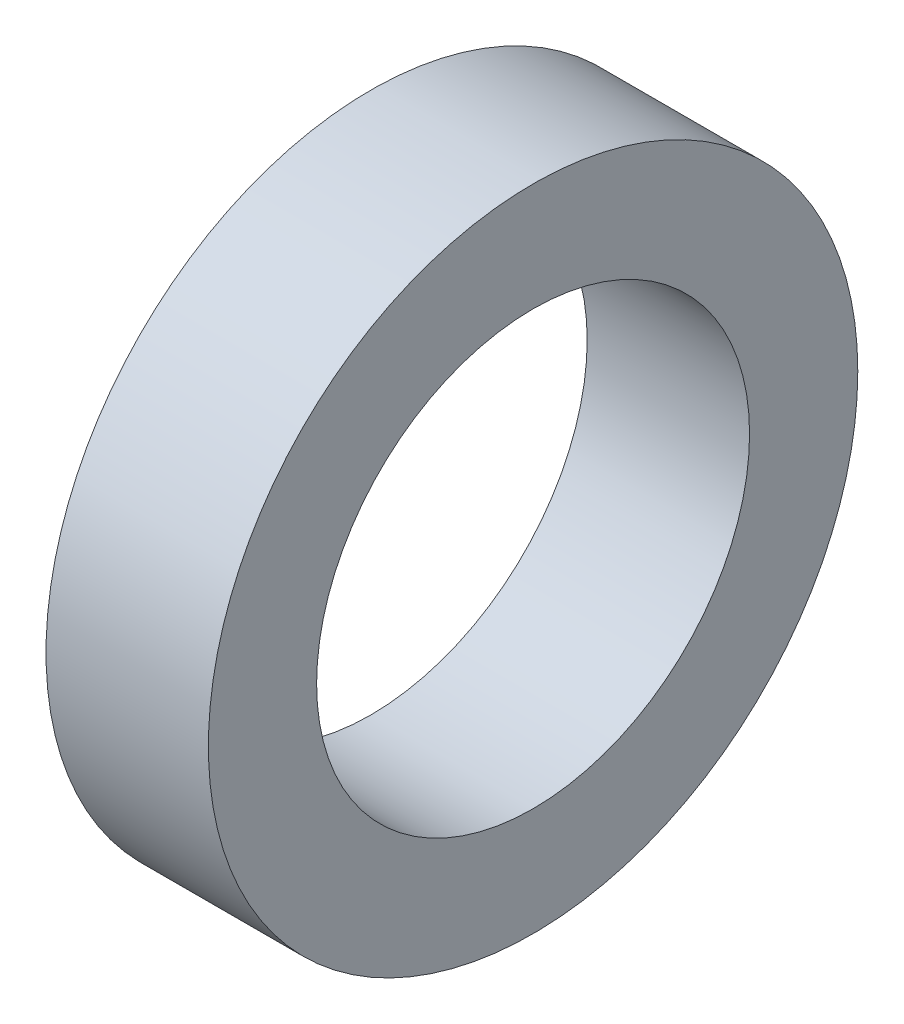
from build123d import *

# Parameters (mm, degrees)
SKETCH2_R           = 30
SKETCH2_R_2         = 20
BOSS_EXTRUDE6_DEPTH = 15


with BuildPart() as part:
    # Sketch2 → Boss-Extrude6 (new body)
    with BuildSketch(Plane(origin=(0, 0, 0), x_dir=(0, 0, -1), z_dir=(1, 0, 0))):
        Circle(SKETCH2_R)
        Circle(SKETCH2_R_2, mode=Mode.SUBTRACT)
    extrude(amount=BOSS_EXTRUDE6_DEPTH)


solid = part.part
